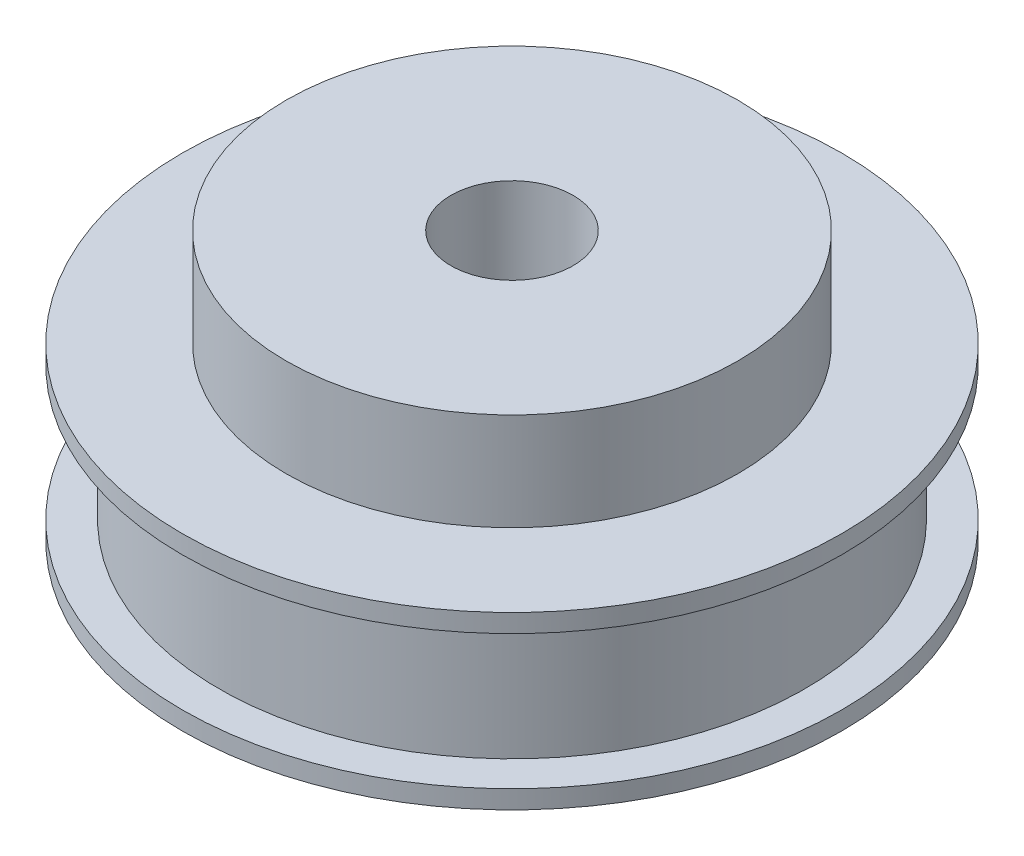
from build123d import *


with BuildPart() as part:
    # Esquisse1 → Révolution1 (revolve)
    with BuildSketch(Plane.XY):
        Polygon((5, 0), (27, 0), (27, 1.5), (24, 1.5), (24, 12.5), (27, 12.5), (27, 14), (18.5, 14), (18.5, 22), (5, 22), align=None)
    revolve(axis=Axis((0, 0, 0), (0, 1, 0)))


solid = part.part
